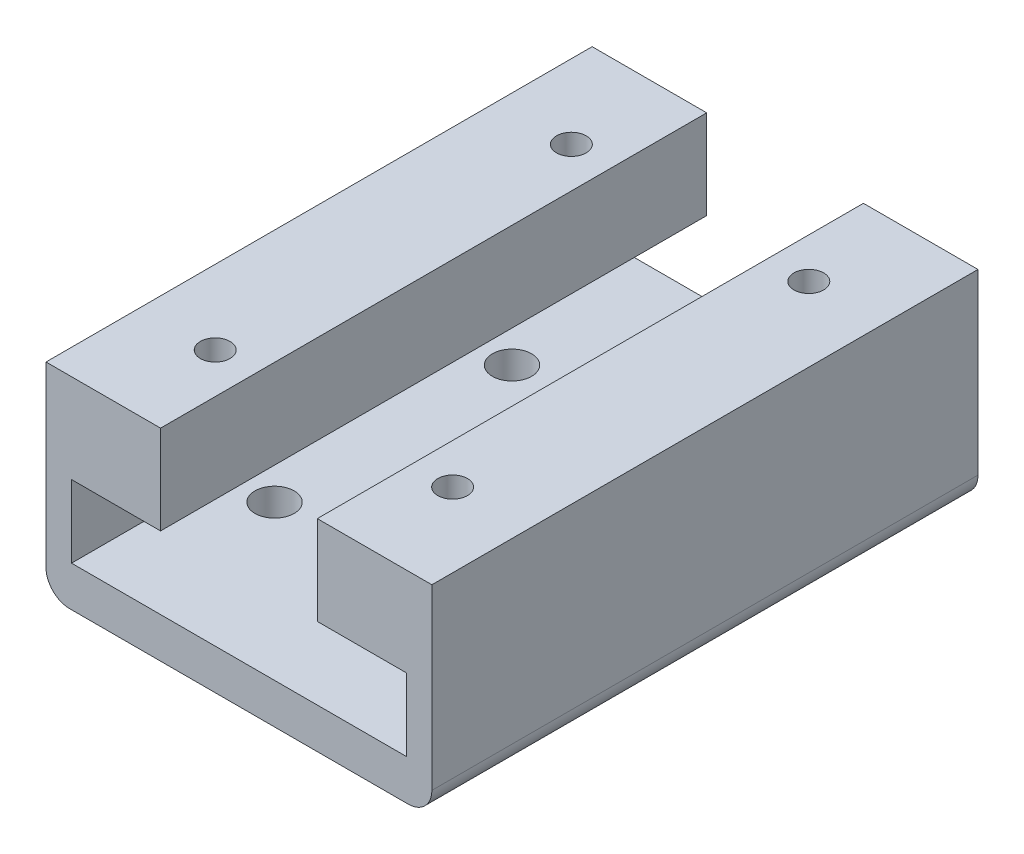
from build123d import *

# Parameters (mm, degrees)
SKETCH_1_W          = 32.5
SKETCH_1_H          = 46
EXTRUDE_1_DEPTH     = 17
CUT_EXTRUDE_2_DEPTH = 52.662970298
CUT_EXTRUDE_3_REACH = 34.895
SKETCH_4_R          = 1.65
SKETCH_5_R          = 1.25
CUT_EXTRUDE_4_DEPTH = 2
FILLET_1_R          = 2


with BuildPart() as part:
    # 草图1 → 凸台-拉伸1 (new body)
    with BuildSketch(Plane(origin=(0, 0, 0), x_dir=(1, 0, 0), z_dir=(0, 1, 0))):
        Rectangle(SKETCH_1_W, SKETCH_1_H)
    extrude(amount=EXTRUDE_1_DEPTH)

    # 草图2 → 切除-拉伸2 (cut, through all)
    with BuildSketch(Plane(origin=(0, 0, -23), x_dir=(-1, 0, 0), z_dir=(0, 0, -1))):
        Polygon((-6.6, 17), (-6.6, 9.5), (-14.1, 9.5), (-14.1, 3.4), (14.1, 3.4), (14.1, 9.5), (6.6, 9.5), (6.6, 17), align=None)
    extrude(amount=-CUT_EXTRUDE_2_DEPTH, mode=Mode.SUBTRACT)

    # 草图4 → 切除-拉伸3 (cut, up to next)
    with BuildSketch(Plane.XZ, mode=Mode.PRIVATE) as cut_extrude_3_sk1:
        with Locations((-10, 10)):
            Circle(SKETCH_4_R)
    cut_extrude_3_tool1 = extrude(cut_extrude_3_sk1.sketch, amount=-CUT_EXTRUDE_3_REACH, mode=Mode.PRIVATE) & part.part
    # 草图4 → 切除-拉伸3 (cut, up to next)
    with BuildSketch(Plane.XZ, mode=Mode.PRIVATE) as cut_extrude_3_sk2:
        with Locations((10, 10)):
            Circle(SKETCH_4_R)
    cut_extrude_3_tool2 = extrude(cut_extrude_3_sk2.sketch, amount=-CUT_EXTRUDE_3_REACH, mode=Mode.PRIVATE) & part.part
    # 草图4 → 切除-拉伸3 (cut, up to next)
    with BuildSketch(Plane.XZ, mode=Mode.PRIVATE) as cut_extrude_3_sk3:
        with Locations((10, -10)):
            Circle(SKETCH_4_R)
    cut_extrude_3_tool3 = extrude(cut_extrude_3_sk3.sketch, amount=-CUT_EXTRUDE_3_REACH, mode=Mode.PRIVATE) & part.part
    # 草图4 → 切除-拉伸3 (cut, up to next)
    with BuildSketch(Plane.XZ, mode=Mode.PRIVATE) as cut_extrude_3_sk4:
        with Locations((-10, -10)):
            Circle(SKETCH_4_R)
    cut_extrude_3_tool4 = extrude(cut_extrude_3_sk4.sketch, amount=-CUT_EXTRUDE_3_REACH, mode=Mode.PRIVATE) & part.part
    add(cut_extrude_3_tool1.solids().sort_by_distance((-10, 0, 10))[0], mode=Mode.SUBTRACT)
    add(cut_extrude_3_tool2.solids().sort_by_distance((10, 0, 10))[0], mode=Mode.SUBTRACT)
    add(cut_extrude_3_tool3.solids().sort_by_distance((10, 0, -10))[0], mode=Mode.SUBTRACT)
    add(cut_extrude_3_tool4.solids().sort_by_distance((-10, 0, -10))[0], mode=Mode.SUBTRACT)

    # 草图5 → 切除-拉伸4 (cut)
    with BuildSketch(Plane(origin=(0, 17, 0), x_dir=(1, 0, 0), z_dir=(0, 1, 0))):
        with Locations((-10, 15)):
            Circle(SKETCH_5_R)
        with Locations((10, 15)):
            Circle(SKETCH_5_R)
        with Locations((10, -15)):
            Circle(SKETCH_5_R)
        with Locations((-10, -15)):
            Circle(SKETCH_5_R)
    extrude(amount=-CUT_EXTRUDE_4_DEPTH, mode=Mode.SUBTRACT)

    # 圆角1
    fillet_1_edges = [part.edges().sort_by_distance(p)[0] for p in [
        (16.25, 0, 0),
        (-16.25, 0, 0),
    ]]
    fillet(fillet_1_edges, radius=FILLET_1_R)


solid = part.part
